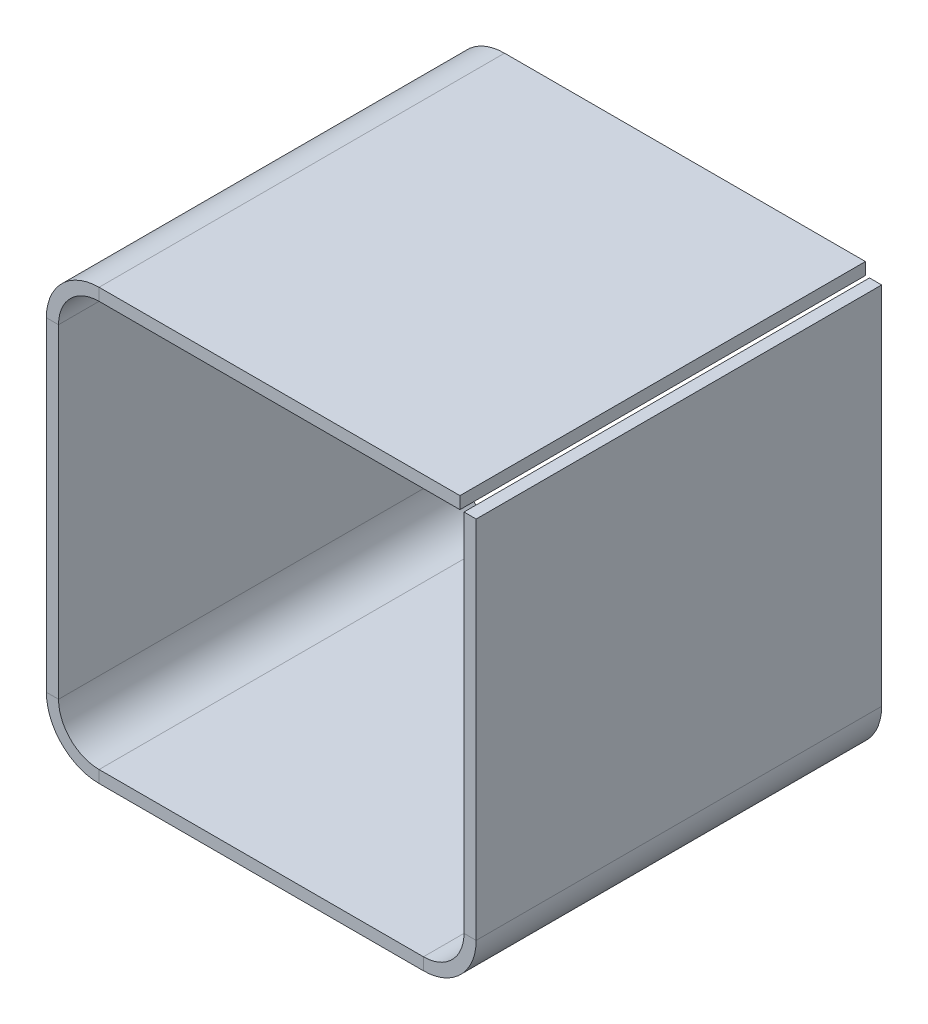
from build123d import *

# Parameters (mm, degrees)
T_LE_DE_BASE_PLI_E1_DEPTH = 100


# Sheet-metal steps are written as plain solids
with BuildPart() as part:
    # Esquisse1 → Tôle de base pliée1 (new body)
    with BuildSketch(Plane.XY):
        with BuildLine():
            Line((54.309394529, 100), (-34.690605471, 100))
            ThreePointArc((-34.690605471, 100), (-41.761673283, 97.071067812), (-44.690605471, 90))
            Line((-44.690605471, 90), (-44.690605471, 10))
            ThreePointArc((-44.690605471, 10), (-41.761673283, 2.928932188), (-34.690605471, 0))
            Line((-34.690605471, 0), (45.309394529, 0))
            ThreePointArc((45.309394529, 0), (52.38046234, 2.928932188), (55.309394529, 10))
            Line((55.309394529, 10), (55.309394529, 100))
            Line((55.309394529, 100), (58.309394529, 100))
            Line((58.309394529, 100), (58.309394529, 10))
            ThreePointArc((58.309394529, 10), (54.501782684, 0.807611845), (45.309394529, -3))
            Line((45.309394529, -3), (-34.690605471, -3))
            ThreePointArc((-34.690605471, -3), (-43.882993627, 0.807611845), (-47.690605471, 10))
            Line((-47.690605471, 10), (-47.690605471, 90))
            ThreePointArc((-47.690605471, 90), (-43.882993627, 99.192388155), (-34.690605471, 103))
            Line((-34.690605471, 103), (54.309394529, 103))
            Line((54.309394529, 103), (54.309394529, 100))
        make_face()
    extrude(amount=T_LE_DE_BASE_PLI_E1_DEPTH)


solid = part.part
